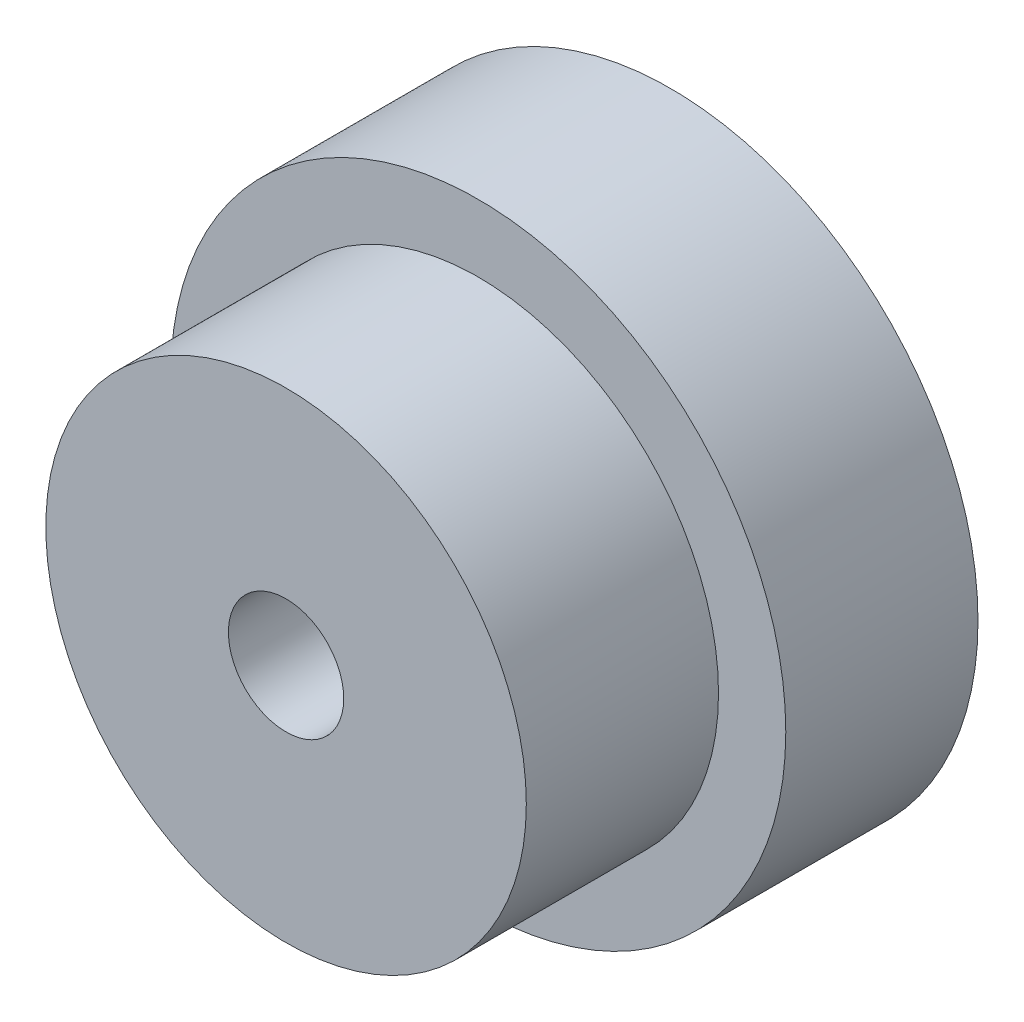
from build123d import *

# Parameters (mm, degrees)
SKETCH1_R           = 16
SKETCH1_R_2         = 3
BOSS_EXTRUDE1_DEPTH = 10
SKETCH1_3_R         = 12.5
SKETCH1_3_R_2       = 3
BOSS_EXTRUDE2_DEPTH = 20


with BuildPart() as part:
    # Sketch1 → Boss-Extrude1 (new body)
    with BuildSketch(Plane.XY):
        Circle(SKETCH1_R)
        Circle(SKETCH1_R_2, mode=Mode.SUBTRACT)
    extrude(amount=BOSS_EXTRUDE1_DEPTH)

    # Sketch1<3> → Boss-Extrude2 (add)
    with BuildSketch(Plane.XY):
        Circle(SKETCH1_3_R)
        Circle(SKETCH1_3_R_2, mode=Mode.SUBTRACT)
    extrude(amount=BOSS_EXTRUDE2_DEPTH)


solid = part.part
